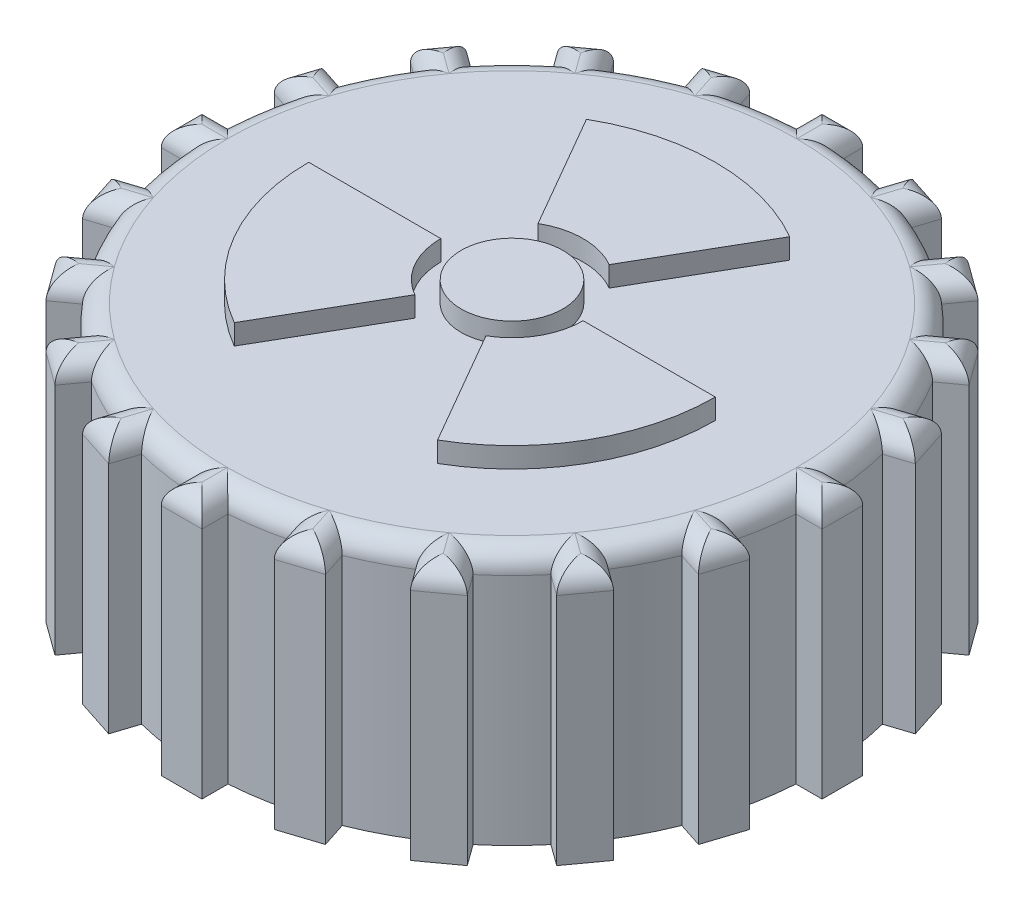
from build123d import *

# Parameters (mm, degrees)
SKETCH1_R             = 30
SKETCH1_R_2           = 25
BOSS_EXTRUDE1_DEPTH   = 20
BOSS_EXTRUDE2_START   = 5
SKETCH2_R             = 30
BOSS_EXTRUDE2_DEPTH   = 5
BOSS_EXTRUDE3_DEPTH   = 25
FILLET1_R             = 2
SKETCH4_R             = 5
BOSS_EXTRUDE4_DEPTH   = 2
BOSS_EXTRUDE4_2_DEPTH = 2
BOSS_EXTRUDE4_3_DEPTH = 2
BOSS_EXTRUDE4_4_DEPTH = 2


with BuildPart() as part:
    # Sketch1 → Boss-Extrude1 (new body)
    with BuildSketch(Plane(origin=(0, 0, 0), x_dir=(1, 0, 0), z_dir=(0, 1, 0))):
        with Locations(Location((0, 0, 0), (0, 0, 270))):
            Circle(SKETCH1_R)
        with Locations(Location((0, 0, 0), (0, 0, 270))):
            Circle(SKETCH1_R_2, mode=Mode.SUBTRACT)
    extrude(amount=-BOSS_EXTRUDE1_DEPTH)

    # Sketch2 → Boss-Extrude2 (add)
    with BuildSketch(Plane(origin=(0, 0, 0), x_dir=(1, 0, 0), z_dir=(0, 1, 0)).offset(BOSS_EXTRUDE2_START)):
        with Locations(Location((0, 0, 0), (0, 0, 270))):
            Circle(SKETCH2_R)
    extrude(amount=-BOSS_EXTRUDE2_DEPTH)

    # Sketch3 → Boss-Extrude3 (add)
    with BuildSketch(Plane(origin=(0, 5, 0), x_dir=(1, 0, 0), z_dir=(0, 1, 0))):
        with BuildLine():
            Line((11.15199879, 27.850187127), (11.94516535, 30.291302791))
            Line((11.94516535, 30.291302791), (8.140939285, 31.527370768))
            Line((8.140939285, 31.527370768), (7.347772725, 29.086255104))
            ThreePointArc((7.347772725, 29.086255104), (9.270509831, 28.531695489), (11.15199879, 27.850187127))
        make_face()
        with BuildLine():
            Line((-2, 29.933259094), (-2, 32.5))
            Line((-2, 32.5), (2, 32.5))
            Line((2, 32.5), (2, 29.933259094))
            ThreePointArc((2, 29.933259094), (0, 30), (-2, 29.933259094))
        make_face()
        with BuildLine():
            Line((19.212362237, 23.0409448), (20.721054688, 25.117481813))
            Line((20.721054688, 25.117481813), (17.484986711, 27.468622822))
            Line((17.484986711, 27.468622822), (15.97629426, 25.392085809))
            ThreePointArc((15.97629426, 25.392085809), (17.633557569, 24.270509831), (19.212362237, 23.0409448))
        make_face()
        with BuildLine():
            Line((25.392085809, 15.97629426), (27.468622822, 17.484986711))
            Line((27.468622822, 17.484986711), (25.117481813, 20.721054688))
            Line((25.117481813, 20.721054688), (23.0409448, 19.212362237))
            ThreePointArc((23.0409448, 19.212362237), (24.270509831, 17.633557569), (25.392085809, 15.97629426))
        make_face()
        with BuildLine():
            Line((29.086255104, 7.347772725), (31.527370768, 8.140939285))
            Line((31.527370768, 8.140939285), (30.291302791, 11.94516535))
            Line((30.291302791, 11.94516535), (27.850187127, 11.15199879))
            ThreePointArc((27.850187127, 11.15199879), (28.531695489, 9.270509831), (29.086255104, 7.347772725))
        make_face()
        with BuildLine():
            Line((29.933259094, -2), (32.5, -2))
            Line((32.5, -2), (32.5, 2))
            Line((32.5, 2), (29.933259094, 2))
            ThreePointArc((29.933259094, 2), (30, 0), (29.933259094, -2))
        make_face()
        with BuildLine():
            Line((27.850187127, -11.15199879), (30.291302791, -11.94516535))
            Line((30.291302791, -11.94516535), (31.527370768, -8.140939285))
            Line((31.527370768, -8.140939285), (29.086255104, -7.347772725))
            ThreePointArc((29.086255104, -7.347772725), (28.531695489, -9.270509831), (27.850187127, -11.15199879))
        make_face()
        with BuildLine():
            Line((23.0409448, -19.212362237), (25.117481813, -20.721054688))
            Line((25.117481813, -20.721054688), (27.468622822, -17.484986711))
            Line((27.468622822, -17.484986711), (25.392085809, -15.97629426))
            ThreePointArc((25.392085809, -15.97629426), (24.270509831, -17.633557569), (23.0409448, -19.212362237))
        make_face()
        with BuildLine():
            Line((15.97629426, -25.392085809), (17.484986711, -27.468622822))
            Line((17.484986711, -27.468622822), (20.721054688, -25.117481813))
            Line((20.721054688, -25.117481813), (19.212362237, -23.0409448))
            ThreePointArc((19.212362237, -23.0409448), (17.633557569, -24.270509831), (15.97629426, -25.392085809))
        make_face()
        with BuildLine():
            Line((7.347772725, -29.086255104), (8.140939285, -31.527370768))
            Line((8.140939285, -31.527370768), (11.94516535, -30.291302791))
            Line((11.94516535, -30.291302791), (11.15199879, -27.850187127))
            ThreePointArc((11.15199879, -27.850187127), (9.270509831, -28.531695489), (7.347772725, -29.086255104))
        make_face()
        with BuildLine():
            Line((-2, -29.933259094), (-2, -32.5))
            Line((-2, -32.5), (2, -32.5))
            Line((2, -32.5), (2, -29.933259094))
            ThreePointArc((2, -29.933259094), (0, -30), (-2, -29.933259094))
        make_face()
        with BuildLine():
            Line((-11.15199879, -27.850187127), (-11.94516535, -30.291302791))
            Line((-11.94516535, -30.291302791), (-8.140939285, -31.527370768))
            Line((-8.140939285, -31.527370768), (-7.347772725, -29.086255104))
            ThreePointArc((-7.347772725, -29.086255104), (-9.270509831, -28.531695489), (-11.15199879, -27.850187127))
        make_face()
        with BuildLine():
            Line((-19.212362237, -23.0409448), (-20.721054688, -25.117481813))
            Line((-20.721054688, -25.117481813), (-17.484986711, -27.468622822))
            Line((-17.484986711, -27.468622822), (-15.97629426, -25.392085809))
            ThreePointArc((-15.97629426, -25.392085809), (-17.633557569, -24.270509831), (-19.212362237, -23.0409448))
        make_face()
        with BuildLine():
            Line((-25.392085809, -15.97629426), (-27.468622822, -17.484986711))
            Line((-27.468622822, -17.484986711), (-25.117481813, -20.721054688))
            Line((-25.117481813, -20.721054688), (-23.0409448, -19.212362237))
            ThreePointArc((-23.0409448, -19.212362237), (-24.270509831, -17.633557569), (-25.392085809, -15.97629426))
        make_face()
        with BuildLine():
            Line((-29.086255104, -7.347772725), (-31.527370768, -8.140939285))
            Line((-31.527370768, -8.140939285), (-30.291302791, -11.94516535))
            Line((-30.291302791, -11.94516535), (-27.850187127, -11.15199879))
            ThreePointArc((-27.850187127, -11.15199879), (-28.531695489, -9.270509831), (-29.086255104, -7.347772725))
        make_face()
        with BuildLine():
            Line((-29.933259094, 2), (-32.5, 2))
            Line((-32.5, 2), (-32.5, -2))
            Line((-32.5, -2), (-29.933259094, -2))
            ThreePointArc((-29.933259094, -2), (-30, 0), (-29.933259094, 2))
        make_face()
        with BuildLine():
            Line((-27.850187127, 11.15199879), (-30.291302791, 11.94516535))
            Line((-30.291302791, 11.94516535), (-31.527370768, 8.140939285))
            Line((-31.527370768, 8.140939285), (-29.086255104, 7.347772725))
            ThreePointArc((-29.086255104, 7.347772725), (-28.531695489, 9.270509831), (-27.850187127, 11.15199879))
        make_face()
        with BuildLine():
            Line((-23.0409448, 19.212362237), (-25.117481813, 20.721054688))
            Line((-25.117481813, 20.721054688), (-27.468622822, 17.484986711))
            Line((-27.468622822, 17.484986711), (-25.392085809, 15.97629426))
            ThreePointArc((-25.392085809, 15.97629426), (-24.270509831, 17.633557569), (-23.0409448, 19.212362237))
        make_face()
        with BuildLine():
            Line((-15.97629426, 25.392085809), (-17.484986711, 27.468622822))
            Line((-17.484986711, 27.468622822), (-20.721054688, 25.117481813))
            Line((-20.721054688, 25.117481813), (-19.212362237, 23.0409448))
            ThreePointArc((-19.212362237, 23.0409448), (-17.633557569, 24.270509831), (-15.97629426, 25.392085809))
        make_face()
        with BuildLine():
            Line((-7.347772725, 29.086255104), (-8.140939285, 31.527370768))
            Line((-8.140939285, 31.527370768), (-11.94516535, 30.291302791))
            Line((-11.94516535, 30.291302791), (-11.15199879, 27.850187127))
            ThreePointArc((-11.15199879, 27.850187127), (-9.270509831, 28.531695489), (-7.347772725, 29.086255104))
        make_face()
    extrude(amount=-BOSS_EXTRUDE3_DEPTH)

    # Fillet1
    fillet1_edges = [part.edges().sort_by_distance(p)[0] for p in [
        (21.213203436, 5, 21.213203436),
        (19.1030207, 5, 26.293052317),
        (19.966708463, 5, 24.079213306),
        (16.730640485, 5, 26.430354315),
        (13.619714992, 5, 26.730195726),
        (10.043052317, 5, 30.90933678),
        (11.54858207, 5, 29.070744959),
        (7.744356005, 5, 30.306812936),
        (4.693033951, 5, 29.630650218),
        (0, 5, 32.5),
        (2, 5, 31.216629547),
        (-2, 5, 31.216629547),
        (-4.693033951, 5, 29.630650218),
        (-10.043052317, 5, 30.90933678),
        (-7.744356005, 5, 30.306812936),
        (-11.54858207, 5, 29.070744959),
        (-4.693033951, 5, -29.630650218),
        (-13.619714992, 5, 26.730195726),
        (-19.1030207, 5, 26.293052317),
        (-16.730640485, 5, 26.430354315),
        (-19.966708463, 5, 24.079213306),
        (-21.213203436, 5, 21.213203436),
        (-26.293052317, 5, 19.1030207),
        (-24.079213306, 5, 19.966708463),
        (-26.430354315, 5, 16.730640485),
        (-26.730195726, 5, 13.619714992),
        (-30.90933678, 5, 10.043052317),
        (-29.070744959, 5, 11.54858207),
        (-30.306812936, 5, 7.744356005),
        (2, 5, -31.216629547),
        (0, 5, -32.5),
        (-29.630650218, 5, 4.693033951),
        (-2, 5, -31.216629547),
        (-32.5, 5, 0),
        (-31.216629547, 5, 2),
        (-31.216629547, 5, -2),
        (-29.630650218, 5, -4.693033951),
        (-30.90933678, 5, -10.043052317),
        (-30.306812936, 5, -7.744356005),
        (-29.070744959, 5, -11.54858207),
        (-26.730195726, 5, -13.619714992),
        (-26.293052317, 5, -19.1030207),
        (-26.430354315, 5, -16.730640485),
        (-24.079213306, 5, -19.966708463),
        (-21.213203436, 5, -21.213203436),
        (-19.1030207, 5, -26.293052317),
        (-19.966708463, 5, -24.079213306),
        (-16.730640485, 5, -26.430354315),
        (-13.619714992, 5, -26.730195726),
        (-10.043052317, 5, -30.90933678),
        (-11.54858207, 5, -29.070744959),
        (-7.744356005, 5, -30.306812936),
        (4.693033951, 5, -29.630650218),
        (10.043052317, 5, -30.90933678),
        (7.744356005, 5, -30.306812936),
        (11.54858207, 5, -29.070744959),
        (13.619714992, 5, -26.730195726),
        (19.1030207, 5, -26.293052317),
        (16.730640485, 5, -26.430354315),
        (19.966708463, 5, -24.079213306),
        (21.213203436, 5, -21.213203436),
        (26.293052317, 5, -19.1030207),
        (24.079213306, 5, -19.966708463),
        (26.430354315, 5, -16.730640485),
        (26.730195726, 5, -13.619714992),
        (30.90933678, 5, -10.043052317),
        (29.070744959, 5, -11.54858207),
        (30.306812936, 5, -7.744356005),
        (29.630650218, 5, -4.693033951),
        (32.5, 5, 0),
        (31.216629547, 5, -2),
        (31.216629547, 5, 2),
        (29.630650218, 5, 4.693033951),
        (30.90933678, 5, 10.043052317),
        (30.306812936, 5, 7.744356005),
        (29.070744959, 5, 11.54858207),
        (26.730195726, 5, 13.619714992),
        (26.293052317, 5, 19.1030207),
        (26.430354315, 5, 16.730640485),
        (24.079213306, 5, 19.966708463),
    ]]
    fillet(fillet1_edges, radius=FILLET1_R - 0.0001)  # a hair under: the kernel refuses the full size


with BuildPart() as body_2:
    # Sketch4 → Boss-Extrude4 (new body)
    with BuildSketch(Plane(origin=(0, 5, 0), x_dir=(1, 0, 0), z_dir=(0, 1, 0))):
        with Locations(Location((0, 0, 0), (0, 0, 270))):
            Circle(SKETCH4_R)
    extrude(amount=BOSS_EXTRUDE4_DEPTH)


with BuildPart() as body_3:
    # Sketch4 → Boss-Extrude4 2 (new body)
    with BuildSketch(Plane(origin=(0, 5, 0), x_dir=(1, 0, 0), z_dir=(0, 1, 0))):
        with BuildLine():
            Line((-10, 17.320508076), (-3.5, 6.062177826))
            ThreePointArc((-3.5, 6.062177826), (0, 7), (3.5, 6.062177826))
            Line((3.5, 6.062177826), (10, 17.320508076))
            ThreePointArc((10, 17.320508076), (0, 20), (-10, 17.320508076))
        make_face()
    extrude(amount=BOSS_EXTRUDE4_2_DEPTH)


with BuildPart() as body_4:
    # Sketch4 → Boss-Extrude4 3 (new body)
    with BuildSketch(Plane(origin=(0, 5, 0), x_dir=(1, 0, 0), z_dir=(0, 1, 0))):
        with BuildLine():
            Line((20, 0), (7, 0))
            ThreePointArc((7, 0), (6.062177826, -3.5), (3.5, -6.062177826))
            Line((3.5, -6.062177826), (10, -17.320508076))
            ThreePointArc((10, -17.320508076), (17.320508076, -10), (20, 0))
        make_face()
    extrude(amount=BOSS_EXTRUDE4_3_DEPTH)


with BuildPart() as body_5:
    # Sketch4 → Boss-Extrude4 4 (new body)
    with BuildSketch(Plane(origin=(0, 5, 0), x_dir=(1, 0, 0), z_dir=(0, 1, 0))):
        with BuildLine():
            Line((-10, -17.320508076), (-3.5, -6.062177826))
            ThreePointArc((-3.5, -6.062177826), (-6.062177826, -3.5), (-7, 0))
            Line((-7, 0), (-20, 0))
            ThreePointArc((-20, 0), (-17.320508076, -10), (-10, -17.320508076))
        make_face()
    extrude(amount=BOSS_EXTRUDE4_4_DEPTH)


solid = Compound([part.part, body_2.part, body_3.part, body_4.part, body_5.part])
